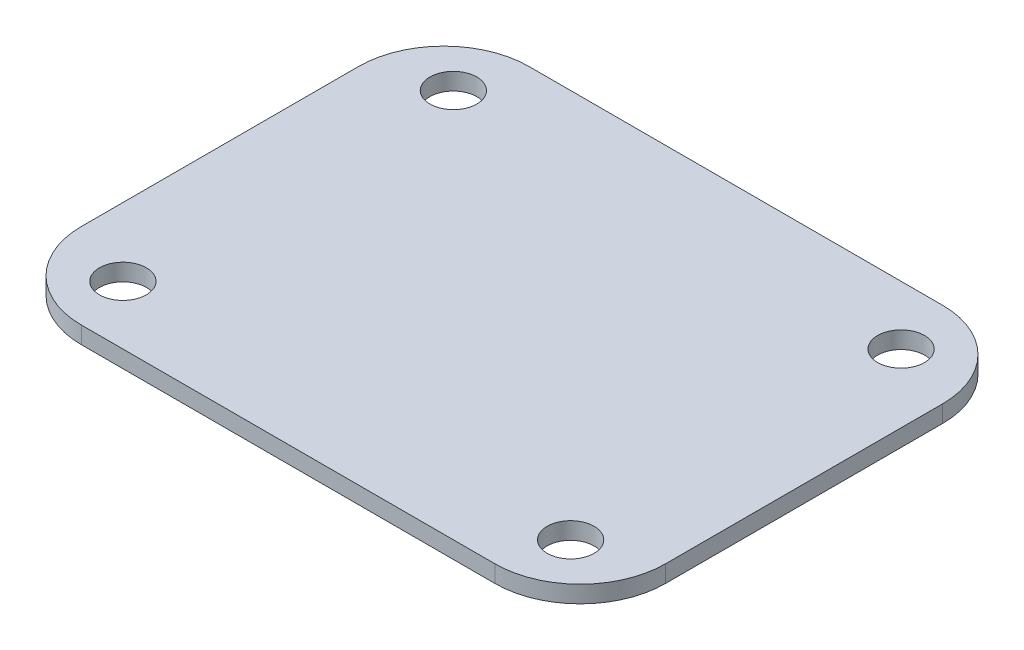
from build123d import *

# Parameters (mm, degrees)
SKETCH_2_R             = 5.5
SM_BASE_FLANGE_1_DEPTH = 4


# Sheet-metal steps are written as plain solids
with BuildPart() as part:
    # Sketch 2 → Базовая кромка1 (new body)
    with BuildSketch(Plane(origin=(0, 0, 0), x_dir=(1, 0, 0), z_dir=(0, 1, 0))):
        with BuildLine():
            Line((-48.5, -52.5), (48.5, -52.5))
            ThreePointArc((48.5, -52.5), (62.642135624, -46.642135624), (68.5, -32.5))
            Line((68.5, -32.5), (68.5, 32.5))
            ThreePointArc((68.5, 32.5), (62.642135624, 46.642135624), (48.5, 52.5))
            Line((48.5, 52.5), (-48.5, 52.5))
            ThreePointArc((-48.5, 52.5), (-62.642135624, 46.642135624), (-68.5, 32.5))
            Line((-68.5, 32.5), (-68.5, -32.5))
            ThreePointArc((-68.5, -32.5), (-62.642135624, -46.642135624), (-48.5, -52.5))
        make_face()
        with Locations(Location((52.5, 38.75, 0), (0, 0, 270))):
            Circle(SKETCH_2_R, mode=Mode.SUBTRACT)
        with Locations(Location((-52.5, 38.75, 0), (0, 0, 90))):
            Circle(SKETCH_2_R, mode=Mode.SUBTRACT)
        with Locations(Location((52.5, -38.75, 0), (0, 0, 90))):
            Circle(SKETCH_2_R, mode=Mode.SUBTRACT)
        with Locations(Location((-52.5, -38.75, 0), (0, 0, 270))):
            Circle(SKETCH_2_R, mode=Mode.SUBTRACT)
    extrude(amount=SM_BASE_FLANGE_1_DEPTH)


solid = part.part
